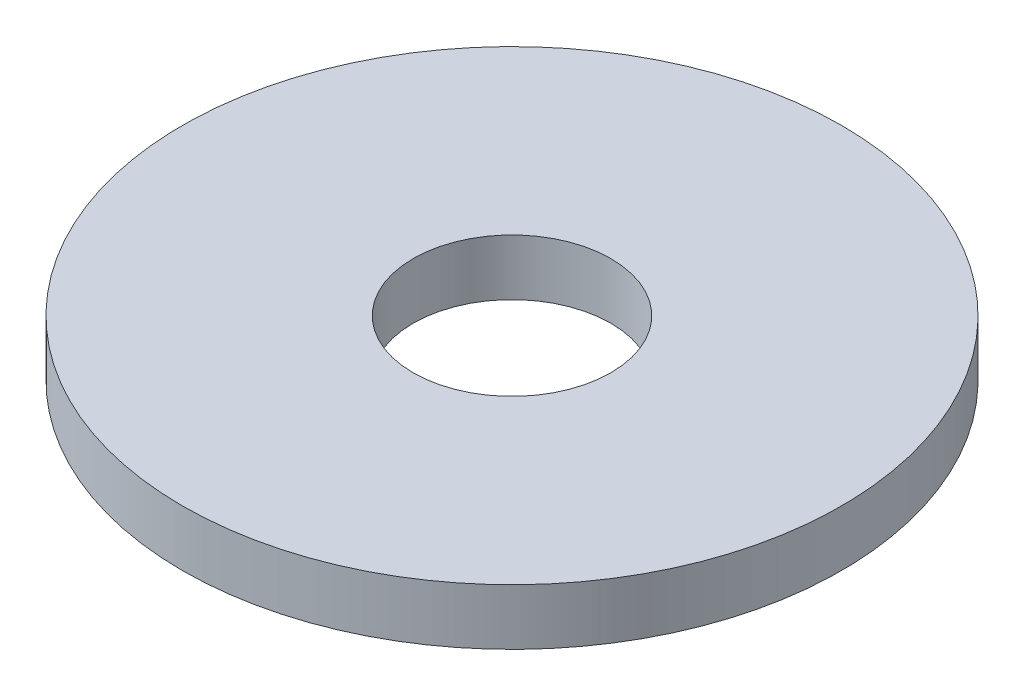
from build123d import *

# Parameters (mm, degrees)
SKETCH1_R           = 100
BOSS_EXTRUDE1_DEPTH = 17
SKETCH2_R           = 30
CUT_EXTRUDE1_DEPTH  = 143.439460825


with BuildPart() as part:
    # Sketch1 → Boss-Extrude1 (new body)
    with BuildSketch(Plane(origin=(0, 0, 0), x_dir=(1, 0, 0), z_dir=(0, 1, 0))):
        Circle(SKETCH1_R)
    extrude(amount=BOSS_EXTRUDE1_DEPTH)

    # Sketch2 → Cut-Extrude1 (cut, through all)
    with BuildSketch(Plane(origin=(0, 0, 0), x_dir=(1, 0, 0), z_dir=(0, 1, 0))):
        Circle(SKETCH2_R)
    extrude(amount=CUT_EXTRUDE1_DEPTH, mode=Mode.SUBTRACT)


solid = part.part
